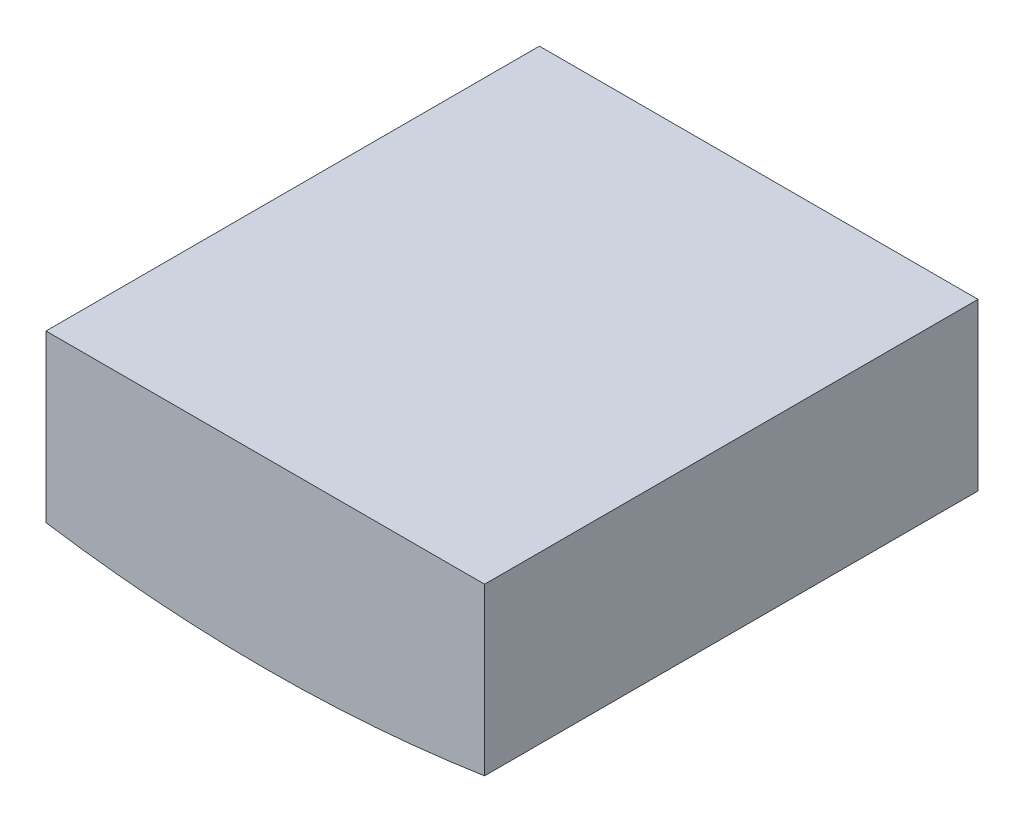
from build123d import *

# Parameters (mm, degrees)
BOSS_EXTRUDE3_DEPTH      = 3
BOSS_EXTRUDE3_DEPTH_BACK = 8
SKETCH4_W                = 24
SKETCH4_H                = 27
SKETCH5_W                = 28.405044576
SKETCH5_H                = 3.736732925


with BuildPart() as part:
    # Sketch4 → Boss-Extrude3 (new, two sides: drawn at the far end of the back side and taken through both)
    with BuildSketch(Plane(origin=(0, 0, 0), x_dir=(1, 0, 0), z_dir=(0, 1, 0)).offset(-BOSS_EXTRUDE3_DEPTH_BACK)):
        Rectangle(SKETCH4_W, SKETCH4_H)
    extrude(amount=BOSS_EXTRUDE3_DEPTH + BOSS_EXTRUDE3_DEPTH_BACK)

    # Sketch5 → Cut-Revolve1 (revolve, cut)
    with BuildSketch(Plane(origin=(0, 0, 0), x_dir=(0, 0, -1), z_dir=(1, 0, 0))):
        with Locations((0.702522288, -8.868366462)):
            Rectangle(SKETCH5_W, SKETCH5_H)
    revolve(axis=Axis((0, 72, 13.5), (0, 0, -1)), mode=Mode.SUBTRACT)


solid = part.part
